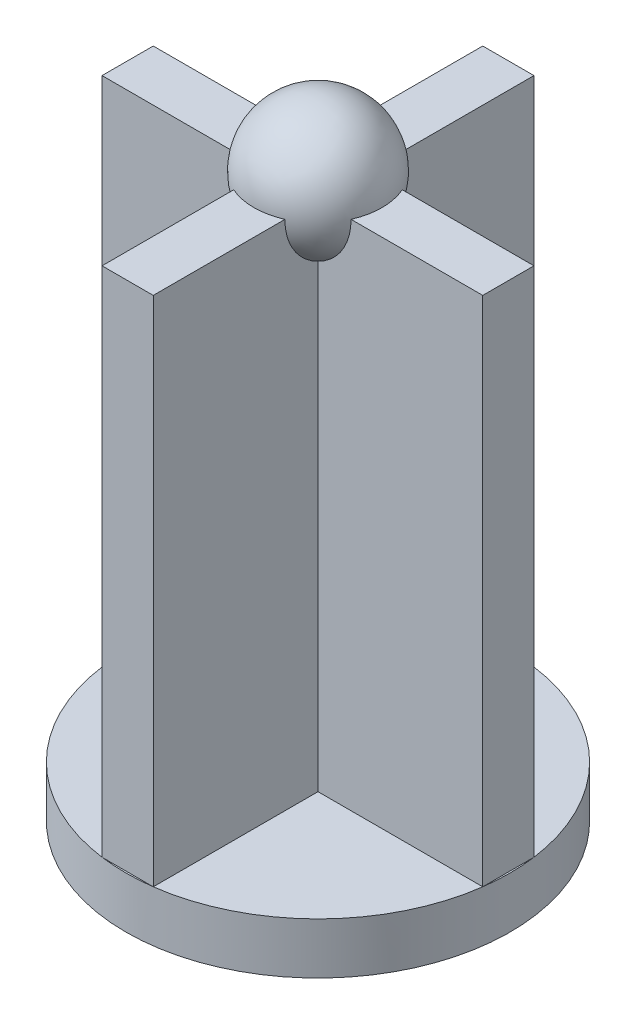
from build123d import *

# Parameters (mm, degrees)
SKETCH1_R           = 37.5
BOSS_EXTRUDE1_DEPTH = 10
BOSS_EXTRUDE2_DEPTH = 100


with BuildPart() as part:
    # Sketch1 → Boss-Extrude1 (new body)
    with BuildSketch(Plane(origin=(0, 0, 0), x_dir=(1, 0, 0), z_dir=(0, 1, 0))):
        Circle(SKETCH1_R)
    extrude(amount=BOSS_EXTRUDE1_DEPTH)

    # Sketch3 → Boss-Extrude2 (add)
    with BuildSketch(Plane(origin=(0, 10, 0), x_dir=(1, 0, 0), z_dir=(0, 1, 0))):
        Polygon((-5, 5), (-5, 37.165171868), (5, 37.165171868), (5, 5), (37.165171868, 5), (37.165171868, -5), (5, -5), (5, -37.165171868), (-5, -37.165171868), (-5, -5), (-37.165171868, -5), (-37.165171868, 5), align=None)
    extrude(amount=BOSS_EXTRUDE2_DEPTH)

    # Sketch4 → Revolve3 (revolve)
    with BuildSketch(Plane(origin=(0, 110, 0), x_dir=(1, 0, 0), z_dir=(0, 1, 0))):
        with BuildLine():
            Line((0, 12.5), (0, -12.5))
            ThreePointArc((0, -12.5), (12.5, 0), (0, 12.5))
        make_face()
    revolve(axis=Axis((0, 110, -12.5), (0, 0, 1)))


solid = part.part
